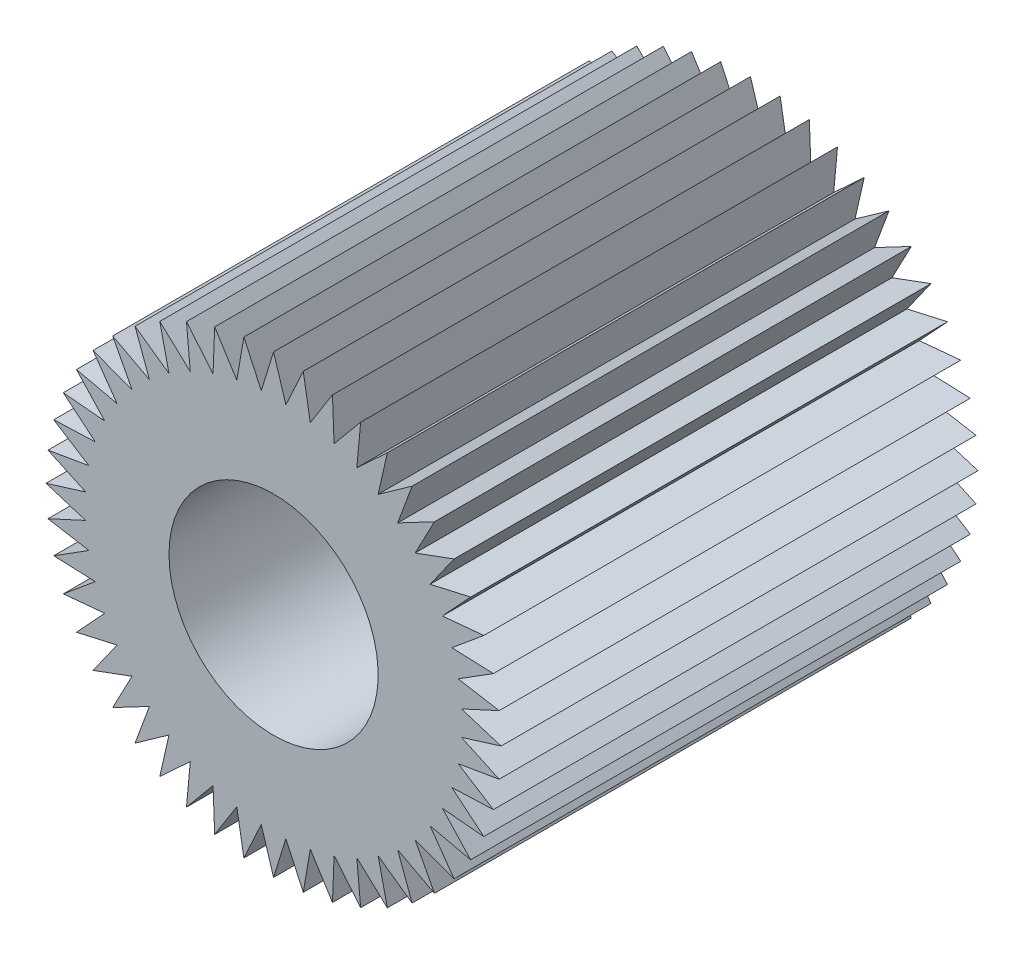
from build123d import *

# Parameters (mm, degrees)
EXTRUDE_1_DEPTH   = 11.4
OTHER_1_OUTLINE_R = 2.5
OTHER_1_DEPTH     = 11.4
SKETCH_9_R        = 1.2


# Read off the part's stored shape, not the designer's step: 孔1
with BuildPart() as part:
    # 草图6 → 凸台-拉伸1 (new body)
    with BuildSketch(Plane.XY):
        Polygon((5.393460046, -0.710062486), (4.490365155, -0.294314082), (5.44, 0), (4.490365155, 0.294314082), (5.393460046, 0.710062486), (4.413533762, 0.877906449), (5.254636495, 1.407975605), (4.261185583, 1.446477594), (5.025904657, 2.081797872), (4.035927337, 1.990299106), (4.711178197, 2.72), (3.741613255, 2.500066049), (4.315842171, 3.311662174), (3.383279134, 2.967056168), (3.84666089, 3.84666089), (2.967056168, 3.383279134), (3.311662174, 4.315842171), (2.500066049, 3.741613255), (2.72, 4.711178197), (1.990299106, 4.035927337), (2.081797872, 5.025904657), (1.446477594, 4.261185583), (1.407975605, 5.254636495), (0.877906449, 4.413533762), (0.710062486, 5.393460046), (0.294314082, 4.490365155), (0, 5.44), (-0.294314082, 4.490365155), (-0.710062486, 5.393460046), (-0.877906449, 4.413533762), (-1.407975605, 5.254636495), (-1.446477594, 4.261185583), (-2.081797872, 5.025904657), (-1.990299106, 4.035927337), (-2.72, 4.711178197), (-2.500066049, 3.741613255), (-3.311662174, 4.315842171), (-2.967056168, 3.383279134), (-3.84666089, 3.84666089), (-3.383279134, 2.967056168), (-4.315842171, 3.311662174), (-3.741613255, 2.500066049), (-4.711178197, 2.72), (-4.035927337, 1.990299106), (-5.025904657, 2.081797872), (-4.261185583, 1.446477594), (-5.254636495, 1.407975605), (-4.413533762, 0.877906449), (-5.393460046, 0.710062486), (-4.490365155, 0.294314082), (-5.44, 0), (-4.490365155, -0.294314082), (-5.393460046, -0.710062486), (-4.413533762, -0.877906449), (-5.254636495, -1.407975605), (-4.261185583, -1.446477594), (-5.025904657, -2.081797872), (-4.035927337, -1.990299106), (-4.711178197, -2.72), (-3.741613255, -2.500066049), (-4.315842171, -3.311662174), (-3.383279134, -2.967056168), (-3.84666089, -3.84666089), (-2.967056168, -3.383279134), (-3.311662174, -4.315842171), (-2.500066049, -3.741613255), (-2.72, -4.711178197), (-1.990299106, -4.035927337), (-2.081797872, -5.025904657), (-1.446477594, -4.261185583), (-1.407975605, -5.254636495), (-0.877906449, -4.413533762), (-0.710062486, -5.393460046), (-0.294314082, -4.490365155), (0, -5.44), (0.294314082, -4.490365155), (0.710062486, -5.393460046), (0.877906449, -4.413533762), (1.407975605, -5.254636495), (1.446477594, -4.261185583), (2.081797872, -5.025904657), (1.990299106, -4.035927337), (2.72, -4.711178197), (2.500066049, -3.741613255), (3.311662174, -4.315842171), (2.967056168, -3.383279134), (3.84666089, -3.84666089), (3.383279134, -2.967056168), (4.315842171, -3.311662174), (3.741613255, -2.500066049), (4.711178197, -2.72), (4.035927337, -1.990299106), (5.025904657, -2.081797872), (4.261185583, -1.446477594), (5.254636495, -1.407975605), (4.413533762, -0.877906449), align=None)
    extrude(amount=EXTRUDE_1_DEPTH)

    # 孔1 outline → 孔1 (cut)
    with BuildSketch(Plane.XY):
        Circle(OTHER_1_OUTLINE_R)
    extrude(amount=OTHER_1_DEPTH, mode=Mode.SUBTRACT)

    # 切除-扫描1: sweep along a path in 草图10
    with BuildLine(Plane(origin=(0, 0, 0), x_dir=(0, 0, -1), z_dir=(1, 0, 0))) as sweep_1_path:
        Line((-2.8, 0), (-2.8, -5.857853696))
    # 草图9 → 切除-扫描1 (sweep, cut)
    with BuildSketch(Plane(origin=(0, 0, 0), x_dir=(1, 0, 0), z_dir=(0, 1, 0))):
        with Locations((0, -2.8)):
            Circle(SKETCH_9_R)
    sweep(path=sweep_1_path.line, mode=Mode.SUBTRACT)


solid = part.part
